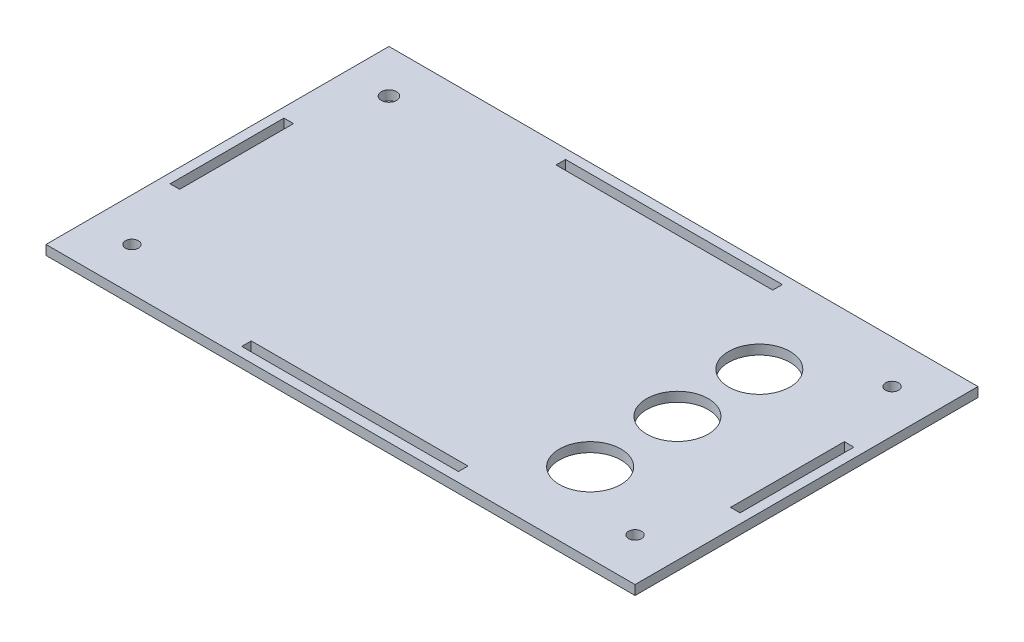
from build123d import *

# Parameters (mm, degrees)
SKETCH2_W           = 123.41
SKETCH2_H           = 71.848
SKETCH2_R           = 1.360904611
SKETCH2_R_2         = 1.6
SKETCH2_R_3         = 6.45
SKETCH2_W_2         = 2
SKETCH2_H_2         = 23.848
SKETCH2_W_3         = 45.41
SKETCH2_H_3         = 2
BOSS_EXTRUDE1_DEPTH = 2


with BuildPart() as part:
    # Sketch2 → Boss-Extrude1 (new body)
    with BuildSketch(Plane(origin=(0, 0, 0), x_dir=(1, 0, 0), z_dir=(0, 1, 0))):
        with Locations((56.48154317, 30.702122774)):
            Rectangle(SKETCH2_W, SKETCH2_H)
        with Locations((3.77654317, 3.778122774)):
            Circle(SKETCH2_R, mode=Mode.SUBTRACT)
        with Locations((109.18654317, 3.778122774)):
            Circle(SKETCH2_R, mode=Mode.SUBTRACT)
        with Locations((3.77654317, 57.626122774)):
            Circle(SKETCH2_R_2, mode=Mode.SUBTRACT)
        with Locations((109.18654317, 57.626122774)):
            Circle(SKETCH2_R, mode=Mode.SUBTRACT)
        with Locations((92.113682499, 29.729556634)):
            Circle(SKETCH2_R_3, mode=Mode.SUBTRACT)
        with Locations((92.113682499, 11.442252985)):
            Circle(SKETCH2_R_3, mode=Mode.SUBTRACT)
        with Locations((92.131948628, 46.863483745)):
            Circle(SKETCH2_R_3, mode=Mode.SUBTRACT)
        with Locations((-2.22345683, 30.702122774)):
            Rectangle(SKETCH2_W_2, SKETCH2_H_2, mode=Mode.SUBTRACT)
        with Locations((56.48154317, 63.626122774)):
            Rectangle(SKETCH2_W_3, SKETCH2_H_3, mode=Mode.SUBTRACT)
        with Locations((115.18654317, 30.702122774)):
            Rectangle(SKETCH2_W_2, SKETCH2_H_2, mode=Mode.SUBTRACT)
        with Locations((56.48154317, -2.221877226)):
            Rectangle(SKETCH2_W_3, SKETCH2_H_3, mode=Mode.SUBTRACT)
    extrude(amount=BOSS_EXTRUDE1_DEPTH)


solid = part.part
